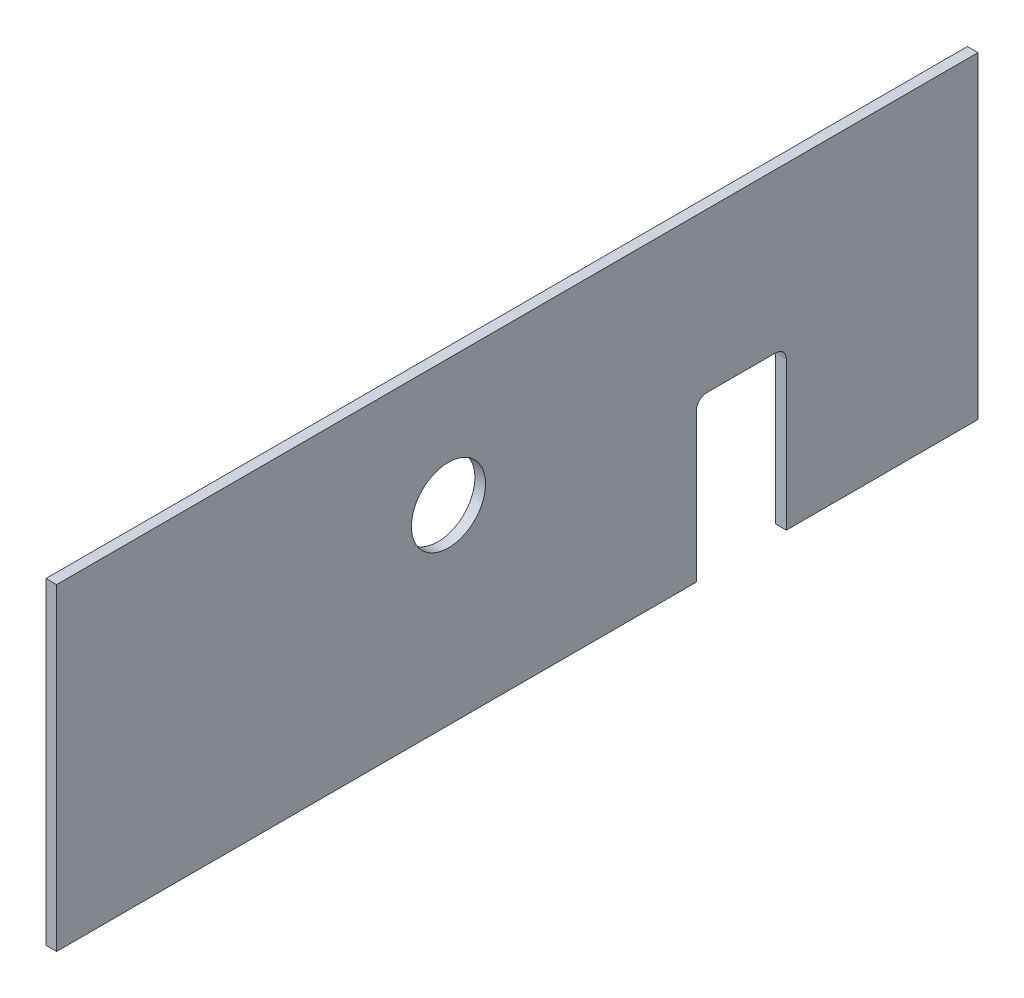
from build123d import *

# Parameters (mm, degrees)
SKETCH1_R           = 3.5
BOSS_EXTRUDE1_DEPTH = 1
FILLET1_R           = 1


with BuildPart() as part:
    # Sketch1 → Boss-Extrude1 (new body)
    with BuildSketch(Plane(origin=(0, 0, 0), x_dir=(0, 0, -1), z_dir=(1, 0, 0))):
        Polygon((-43.5, 15), (-43.5, -15), (16.9, -15), (16.9, 0), (25.4, 0), (25.4, -15), (43.5, -15), (43.5, 15), align=None)
        with Locations((-6.5, 3)):
            Circle(SKETCH1_R, mode=Mode.SUBTRACT)
    extrude(amount=BOSS_EXTRUDE1_DEPTH)

    # Fillet1
    fillet1_edges = [part.edges().sort_by_distance(p)[0] for p in [
        (0.5, 0, -16.9),
        (0.5, 0, -25.4),
    ]]
    fillet(fillet1_edges, radius=FILLET1_R)


solid = part.part
